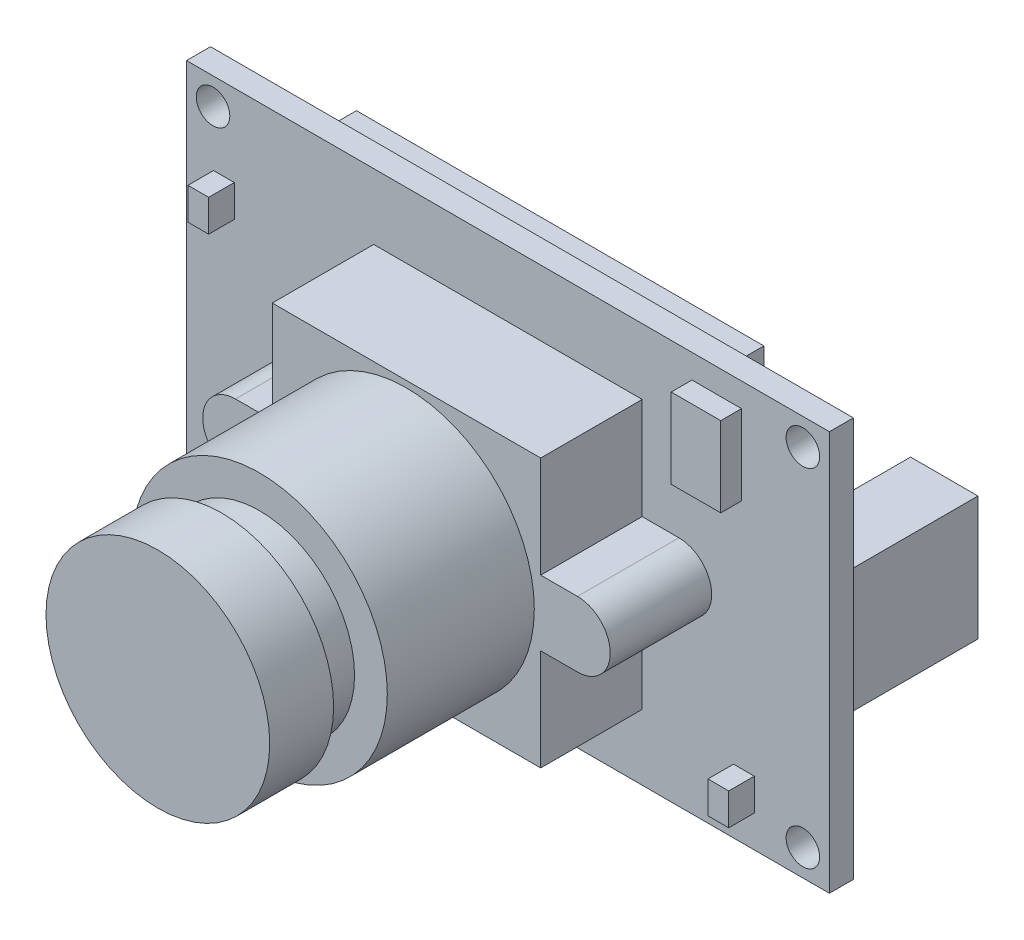
from build123d import *

# Parameters (mm, degrees)
SKETCH2_W            = 40.2336
SKETCH2_H            = 25.019
SKETCH2_R            = 1.05
BOSS_EXTRUDE1_DEPTH  = 1.5
BOSS_EXTRUDE2_DEPTH  = 6.35
SKETCH4_R            = 8
BOSS_EXTRUDE3_DEPTH  = 9.2
SKETCH5_R            = 5.95
BOSS_EXTRUDE4_DEPTH  = 2.36
SKETCH6_R            = 7
BOSS_EXTRUDE5_DEPTH  = 4
SKETCH7_W            = 4.22
SKETCH7_H            = 7.75
BOSS_EXTRUDE6_DEPTH  = 8.3
SKETCH8_W            = 9
SKETCH8_H            = 2.93
BOSS_EXTRUDE7_DEPTH  = 4.35
SKETCH9_W            = 3.1
SKETCH9_H            = 5
BOSS_EXTRUDE8_DEPTH  = 1.3
SKETCH10_W           = 25.5
SKETCH10_H           = 8
BOSS_EXTRUDE9_DEPTH  = 1.4
SKETCH11_W           = 1.3
SKETCH11_H           = 2
BOSS_EXTRUDE10_DEPTH = 1.6
SKETCH12_W           = 3
SKETCH12_H           = 3
BOSS_EXTRUDE11_DEPTH = 1.4
SKETCH13_W           = 3.175
SKETCH13_H           = 2.6162
SKETCH13_W_2         = 8.509
SKETCH13_H_2         = 4.826
BOSS_EXTRUDE12_DEPTH = 2.7432


with BuildPart() as part:
    # Sketch2 → Boss-Extrude1 (new body)
    with BuildSketch(Plane.XY):
        Rectangle(SKETCH2_W, SKETCH2_H)
        with Locations((-18.4568, 10.8495)):
            Circle(SKETCH2_R, mode=Mode.SUBTRACT)
        with Locations((-18.4568, -10.8495)):
            Circle(SKETCH2_R, mode=Mode.SUBTRACT)
        with Locations((18.4568, -10.8495)):
            Circle(SKETCH2_R, mode=Mode.SUBTRACT)
        with Locations((18.4568, 10.8495)):
            Circle(SKETCH2_R, mode=Mode.SUBTRACT)
    extrude(amount=BOSS_EXTRUDE1_DEPTH)

    # Sketch3 → Boss-Extrude2 (add)
    with BuildSketch(Plane.XY.offset(1.5)):
        with BuildLine():
            Line((-8.4, -2.05), (-8.4, -8.4))
            Line((-8.4, -8.4), (8.4, -8.4))
            Line((8.4, -8.4), (8.4, -2.05))
            Line((8.4, -2.05), (10.7, -2.05))
            ThreePointArc((10.7, -2.05), (12.75, 0), (10.7, 2.05))
            Line((10.7, 2.05), (8.4, 2.05))
            Line((8.4, 2.05), (8.4, 8.4))
            Line((8.4, 8.4), (-8.4, 8.4))
            Line((-8.4, 8.4), (-8.4, 2.05))
            Line((-8.4, 2.05), (-10.7, 2.05))
            ThreePointArc((-10.7, 2.05), (-12.75, 0), (-10.7, -2.05))
            Line((-10.7, -2.05), (-8.4, -2.05))
        make_face()
    extrude(amount=BOSS_EXTRUDE2_DEPTH)

    # Sketch4 → Boss-Extrude3 (add)
    with BuildSketch(Plane.XY.offset(7.85)):
        Circle(SKETCH4_R)
    extrude(amount=BOSS_EXTRUDE3_DEPTH)

    # Sketch5 → Boss-Extrude4 (add)
    with BuildSketch(Plane.XY.offset(17.05)):
        Circle(SKETCH5_R)
    extrude(amount=BOSS_EXTRUDE4_DEPTH)

    # Sketch6 → Boss-Extrude5 (add)
    with BuildSketch(Plane.XY.offset(19.41)):
        Circle(SKETCH6_R)
    extrude(amount=BOSS_EXTRUDE5_DEPTH)

    # Sketch7 → Boss-Extrude6 (add)
    with BuildSketch(Plane(origin=(0, 0, 0), x_dir=(-1, 0, 0), z_dir=(0, 0, -1))):
        with Locations((-17.5068, 0)):
            Rectangle(SKETCH7_W, SKETCH7_H)
    extrude(amount=BOSS_EXTRUDE6_DEPTH)

    # Sketch8 → Boss-Extrude7 (add)
    with BuildSketch(Plane(origin=(0, 0, 0), x_dir=(-1, 0, 0), z_dir=(0, 0, -1))):
        with Locations((11.1768, -9.4045)):
            Rectangle(SKETCH8_W, SKETCH8_H)
    extrude(amount=BOSS_EXTRUDE7_DEPTH)

    # Sketch9 → Boss-Extrude8 (add)
    with BuildSketch(Plane.XY.offset(1.5)):
        with Locations((13.0668, 8.5095)):
            Rectangle(SKETCH9_W, SKETCH9_H)
    extrude(amount=BOSS_EXTRUDE8_DEPTH)

    # Sketch10 → Boss-Extrude9 (add)
    with BuildSketch(Plane(origin=(0, 0, 0), x_dir=(-1, 0, 0), z_dir=(0, 0, -1))):
        with Locations((-0.3668, 8.2095)):
            Rectangle(SKETCH10_W, SKETCH10_H)
    extrude(amount=BOSS_EXTRUDE9_DEPTH)

    # Sketch11 → Boss-Extrude10 (add)
    with BuildSketch(Plane.XY.offset(1.5)):
        with Locations((14.7668, -9.5095)):
            Rectangle(SKETCH11_W, SKETCH11_H)
        with Locations((-17.777092667, 6.391636208)):
            Rectangle(SKETCH11_W, SKETCH11_H)
    extrude(amount=BOSS_EXTRUDE10_DEPTH)

    # Sketch12 → Boss-Extrude11 (add)
    with BuildSketch(Plane(origin=(0, 0, 0), x_dir=(-1, 0, 0), z_dir=(0, 0, -1))):
        with Locations((17.6168, 6.6095)):
            Rectangle(SKETCH12_W, SKETCH12_H)
    extrude(amount=BOSS_EXTRUDE11_DEPTH)

    # Sketch13 → Boss-Extrude12 (add)
    with BuildSketch(Plane(origin=(0, 0, 0), x_dir=(-1, 0, 0), z_dir=(0, 0, -1))):
        with Locations((-12.5603, -10.6934)):
            Rectangle(SKETCH13_W, SKETCH13_H)
        with Locations((-2.9083, -9.5885)):
            Rectangle(SKETCH13_W_2, SKETCH13_H_2)
    extrude(amount=BOSS_EXTRUDE12_DEPTH)


solid = part.part
